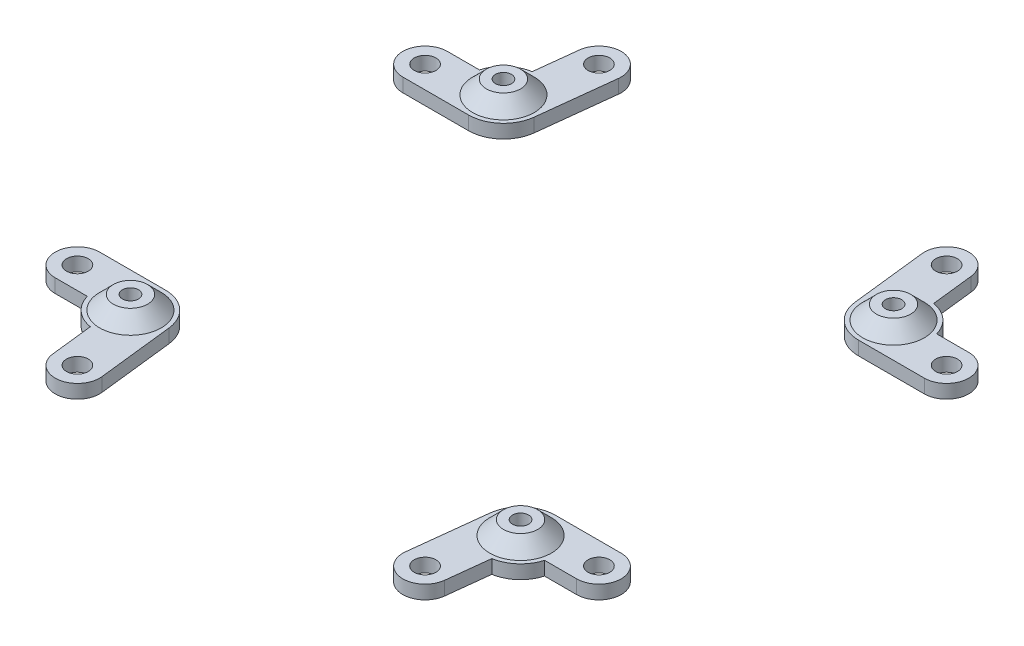
from build123d import *

# Parameters (mm, degrees)
SKETCH3_R           = 2.35
SKETCH3_R_2         = 3.175
BOSS_EXTRUDE1_DEPTH = 4
SKETCH4_R           = 5
SKETCH4_R_2         = 2.35
BOSS_EXTRUDE2_DEPTH = 4
CHAMFER1_SIZE       = 4


with BuildPart() as part:
    # Sketch3 → Boss-Extrude1 (new body)
    with BuildSketch(Plane(origin=(0, 0, 0), x_dir=(1, 0, 0), z_dir=(0, 1, 0))):
        with BuildLine():
            Line((-66.808159868, 57.3), (-76.2, 57.3))
            ThreePointArc((-76.2, 57.3), (-82.7, 50.8), (-76.2, 44.3))
            Line((-76.2, 44.3), (-57, 44.3))
            ThreePointArc((-57, 44.3), (-50.208628415, 46.889660192), (-46.865755779, 53.343672158))
            Line((-46.865755779, 53.343672158), (-44.341903193, 75.463124415))
            ThreePointArc((-44.341903193, 75.463124415), (-50.063124415, 82.658096807), (-57.258096807, 76.936875585))
            Line((-57.258096807, 76.936875585), (-58.670042695, 64.562353472))
            ThreePointArc((-58.670042695, 64.562353472), (-63.791371585, 62.110339808), (-66.808159868, 57.3))
        make_face()
        with Locations(Location((-57, 54.5, 0), (0, 0, 270))):
            Circle(SKETCH3_R, mode=Mode.SUBTRACT)
        with Locations(Location((-50.8, 76.2, 0), (0, 0, 270))):
            Circle(SKETCH3_R_2, mode=Mode.SUBTRACT)
        with Locations(Location((-76.2, 50.8, 0), (0, 0, 270))):
            Circle(SKETCH3_R_2, mode=Mode.SUBTRACT)
    extrude(amount=BOSS_EXTRUDE1_DEPTH)

    # Sketch4 → Boss-Extrude2 (add)
    with BuildSketch(Plane(origin=(0, 4, 0), x_dir=(1, 0, 0), z_dir=(0, 1, 0))):
        with Locations(Location((-57, 54.5, 0), (0, 0, 270))):
            Circle(SKETCH4_R)
        with Locations(Location((-57, 54.5, 0), (0, 0, 270))):
            Circle(SKETCH4_R_2, mode=Mode.SUBTRACT)
    extrude(amount=BOSS_EXTRUDE2_DEPTH)

    # Chamfer1
    chamfer1_edges = [part.edges().sort_by_distance(p)[0] for p in [
        (-57, 4, -59.5),
    ]]
    chamfer(chamfer1_edges, length=CHAMFER1_SIZE - 0.0001)  # a hair under: the kernel refuses the full size


with BuildPart() as body_2:
    # Mirror2: mirrored copy
    add(part.part.mirror(Plane(origin=(0, 0, 0), x_dir=(0, 0, 1), z_dir=(1, 0, 0))))


with BuildPart() as body_3:
    # Mirror3: mirrored copy
    add(part.part.mirror(Plane.XY))


with BuildPart() as body_4:
    # Mirror3 2: mirrored copy
    add(body_2.part.mirror(Plane.XY))


solid = Compound([part.part, body_2.part, body_3.part, body_4.part])
